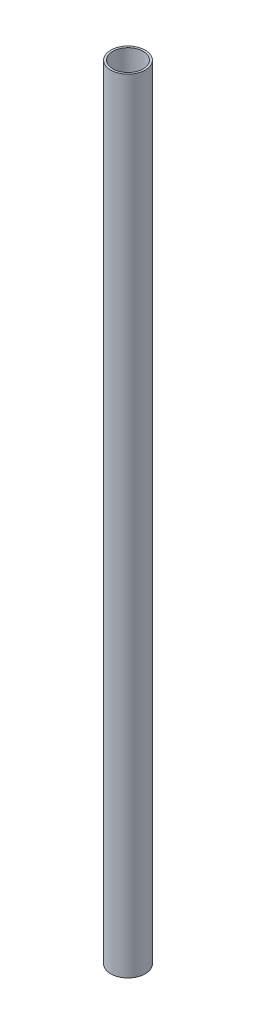
from build123d import *

# Parameters (mm, degrees)
SKETCH1_R           = 8.9662
SKETCH1_R_2         = 7.8994
BOSS_EXTRUDE1_DEPTH = 406.4


with BuildPart() as part:
    # Sketch1 → Boss-Extrude1 (new body)
    with BuildSketch(Plane(origin=(0, 0, 0), x_dir=(1, 0, 0), z_dir=(0, 1, 0))):
        Circle(SKETCH1_R)
        Circle(SKETCH1_R_2, mode=Mode.SUBTRACT)
    extrude(amount=BOSS_EXTRUDE1_DEPTH)


solid = part.part
